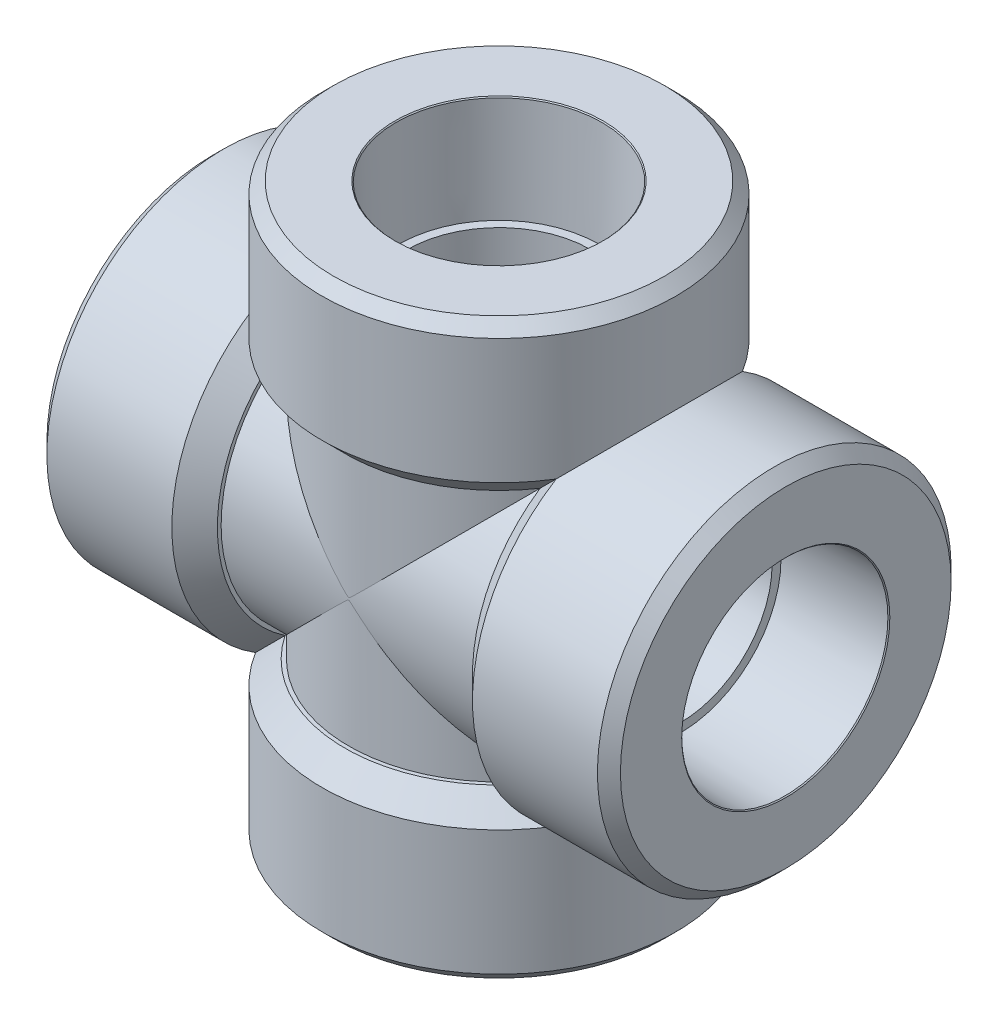
from build123d import *

# Parameters (mm, degrees)
LOFT1_START                 = -38.1
LOFT1_DEPTH                 = 76.2
EXTRUDE1_DEPTH              = 38.1
EXTRUDE1_DEPTH_BACK         = 38.1
SKETCH19_R                  = 19.97075
CIRPATTERN1_COUNT           = 4
SKETCH10_R                  = 13.335
CUT_EXTRUDE1_DEPTH          = 77.656362587
CUT_EXTRUDE1_DRAFT          = 1.5
SKETCH16_R                  = 12.156586861
CUT_EXTRUDE4_DEPTH          = 24.13
CIRPATTERN2_COUNT           = 4
CIRPATTERN2_COPY_1_SKETCH_R = 13.335
CIRPATTERN2_COPY_1_DEPTH    = 77.656362587
CIRPATTERN2_COPY_1_DRAFT    = 1.5
CIRPATTERN2_COPY_2_SKETCH_R = 13.335
CIRPATTERN2_COPY_2_DEPTH    = 77.656362587
CIRPATTERN2_COPY_2_DRAFT    = 1.5
CIRPATTERN2_COPY_3_SKETCH_R = 13.335
CIRPATTERN2_COPY_3_DEPTH    = 77.656362587
CIRPATTERN2_COPY_3_DRAFT    = 1.5


# Read off the part's stored shape, not the designer's step: Loft1
with BuildPart() as part:
    # Loft1 outline → Loft1 (new body)
    with BuildSketch(Plane.YZ.offset(LOFT1_START)):
        with BuildLine():
            add(Edge.make_bspline(
                [(-19.97075, 0), (-19.97075, 2.614165041), (-18.932145195, 7.841465714), (-14.489314141, 14.489697075), (-7.841853874, 18.93146893), (0, 20.491445499), (7.841853874, 18.93146893), (14.489314141, 14.489697075), (18.932145195, 7.841465714), (19.97075, 2.614165041), (19.97075, -2.614165041), (18.932145195, -7.841465714), (14.489314141, -14.489697075), (7.841853874, -18.93146893), (0, -20.491445499), (-7.841853874, -18.93146893), (-14.489314141, -14.489697075), (-18.932145195, -7.841465714), (-19.97075, -2.614165041), (-19.97075, 0)],
                knots=[0, 0, 0, 0, 0.0625, 0.125, 0.1875, 0.25, 0.3125, 0.375, 0.4375, 0.5, 0.5, 0.5625, 0.625, 0.6875, 0.75, 0.8125, 0.875, 0.9375, 1, 1, 1, 1], degree=3))
        make_face()
    extrude(amount=LOFT1_DEPTH)

    # Sketch19 → Extrude1 (add, two sides: drawn at the far end of the back side and taken through both)
    with BuildSketch(Plane(origin=(0, 0, 0), x_dir=(1, 0, 0), z_dir=(0, 1, 0)).offset(-EXTRUDE1_DEPTH_BACK)):
        with Locations(Location((0, 0, 0), (0, 0, 90))):
            Circle(SKETCH19_R)
    extrude(amount=EXTRUDE1_DEPTH + EXTRUDE1_DEPTH_BACK)

    # Sketch8 → Revolve1 (revolve)
    with BuildSketch(Plane.XY):
        Polygon((-38.1, 0), (-16.94576875, 0), (-16.94576875, 20.47001875), (-19.97075, 23.495), (-36.572825, 23.495), (-38.1, 21.967825), align=None)
    revolve1 = revolve(axis=Axis((0, 0, 0), (-1, 0, 0)))

    # CirPattern1: Revolve1 ×4 about axis
    cirpattern1_axis = Axis((0, 0, 0), (0, 0, 1))
    for i in range(1, CIRPATTERN1_COUNT):
        add(revolve1.rotate(cirpattern1_axis, i * 360 / CIRPATTERN1_COUNT))


with BuildPart() as cut_extrude1_tool:
    # Sketch10 → Cut-Extrude1 (with draft: the straight prism first)
    with BuildSketch(Plane(origin=(-24.13, 0, 0), x_dir=(0, 0, -1), z_dir=(1, 0, 0))):
        Circle(SKETCH10_R)
    extrude(amount=-CUT_EXTRUDE1_DEPTH)
    # Cut-Extrude1: the draft: its side faces are tilted about the plane it starts from
    cut_extrude1_sides = [cut_extrude1_tool.faces().sort_by_distance(p)[0] for p in [
        (-62.958181293, 0, 13.335),
    ]]
    draft(cut_extrude1_sides, Plane(origin=(-24.13, 0, 0), x_dir=(0, 0, -1), z_dir=(1, 0, 0)), CUT_EXTRUDE1_DRAFT)


with BuildPart() as part_1:
    add(part.part)

    # Cut-Extrude1: cut by cut_extrude1_tool
    add(cut_extrude1_tool.part, mode=Mode.SUBTRACT)

    # Cut-Extrude3 cone 1 section (through the dimple's axis) → Cut-Extrude3 (revolve, cut)
    with BuildSketch(Plane(origin=(-38.1, 0, 0), x_dir=(0, 0, 1), z_dir=(0, 1, 0))):
        Polygon((0, 0), (13.827817324, 0), (0, 13.827817324), align=None)
    cut_extrude3 = revolve(axis=Axis((-38.1, 0, 0), (1, 0, 0)), mode=Mode.SUBTRACT)

    # Sketch16 → Cut-Extrude4 (cut)
    with BuildSketch(Plane(origin=(-24.13, 0, 0), x_dir=(0, 0, -1), z_dir=(1, 0, 0))):
        with Locations(Location((0, 0, 0), (0, 0, 180))):
            Circle(SKETCH16_R)
    cut_extrude4 = extrude(amount=CUT_EXTRUDE4_DEPTH, mode=Mode.SUBTRACT)

    # CirPattern2: Cut-Extrude3, Cut-Extrude4 ×4 about axis
    cirpattern2_axis = Axis((0, 0, 0), (0, 0, 1))
    add([cut_extrude3.rotate(cirpattern2_axis, i * 360 / CIRPATTERN2_COUNT) for i in range(1, CIRPATTERN2_COUNT)], mode=Mode.SUBTRACT)
    add([cut_extrude4.rotate(cirpattern2_axis, i * 360 / CIRPATTERN2_COUNT) for i in range(1, CIRPATTERN2_COUNT)], mode=Mode.SUBTRACT)


with BuildPart() as cirpattern2_copy_1_tool:
    # CirPattern2 copy 1 sketch → CirPattern2 copy 1 (with draft: the straight prism first)
    with BuildSketch(Plane(origin=(0, -24.13, 0), x_dir=(0, 0, -1), z_dir=(0, 1, 0))):
        Circle(CIRPATTERN2_COPY_1_SKETCH_R)
    extrude(amount=-CIRPATTERN2_COPY_1_DEPTH)
    # CirPattern2 copy 1: the draft: its side faces are tilted about the plane it starts from
    cirpattern2_copy_1_sides = [cirpattern2_copy_1_tool.faces().sort_by_distance(p)[0] for p in [
        (0, -62.958181293, 13.335),
    ]]
    draft(cirpattern2_copy_1_sides, Plane(origin=(0, -24.13, 0), x_dir=(0, 0, -1), z_dir=(0, 1, 0)), CIRPATTERN2_COPY_1_DRAFT)


with BuildPart() as part_2:
    add(part_1.part)

    # CirPattern2 copy 1: cut by cirpattern2_copy_1_tool
    add(cirpattern2_copy_1_tool.part, mode=Mode.SUBTRACT)


with BuildPart() as cirpattern2_copy_2_tool:
    # CirPattern2 copy 2 sketch → CirPattern2 copy 2 (with draft: the straight prism first)
    with BuildSketch(Plane(origin=(24.13, 0, 0), x_dir=(0, 0, -1), z_dir=(-1, 0, 0))):
        Circle(CIRPATTERN2_COPY_2_SKETCH_R)
    extrude(amount=-CIRPATTERN2_COPY_2_DEPTH)
    # CirPattern2 copy 2: the draft: its side faces are tilted about the plane it starts from
    cirpattern2_copy_2_sides = [cirpattern2_copy_2_tool.faces().sort_by_distance(p)[0] for p in [
        (62.958181293, 0, 13.335),
    ]]
    draft(cirpattern2_copy_2_sides, Plane(origin=(24.13, 0, 0), x_dir=(0, 0, -1), z_dir=(-1, 0, 0)), CIRPATTERN2_COPY_2_DRAFT)


with BuildPart() as part_3:
    add(part_2.part)

    # CirPattern2 copy 2: cut by cirpattern2_copy_2_tool
    add(cirpattern2_copy_2_tool.part, mode=Mode.SUBTRACT)


with BuildPart() as cirpattern2_copy_3_tool:
    # CirPattern2 copy 3 sketch → CirPattern2 copy 3 (with draft: the straight prism first)
    with BuildSketch(Plane(origin=(0, 24.13, 0), x_dir=(0, 0, -1), z_dir=(0, -1, 0))):
        Circle(CIRPATTERN2_COPY_3_SKETCH_R)
    extrude(amount=-CIRPATTERN2_COPY_3_DEPTH)
    # CirPattern2 copy 3: the draft: its side faces are tilted about the plane it starts from
    cirpattern2_copy_3_sides = [cirpattern2_copy_3_tool.faces().sort_by_distance(p)[0] for p in [
        (0, 62.958181293, 13.335),
    ]]
    draft(cirpattern2_copy_3_sides, Plane(origin=(0, 24.13, 0), x_dir=(0, 0, -1), z_dir=(0, -1, 0)), CIRPATTERN2_COPY_3_DRAFT)


with BuildPart() as part_4:
    add(part_3.part)

    # CirPattern2 copy 3: cut by cirpattern2_copy_3_tool
    add(cirpattern2_copy_3_tool.part, mode=Mode.SUBTRACT)


solid = part_4.part
